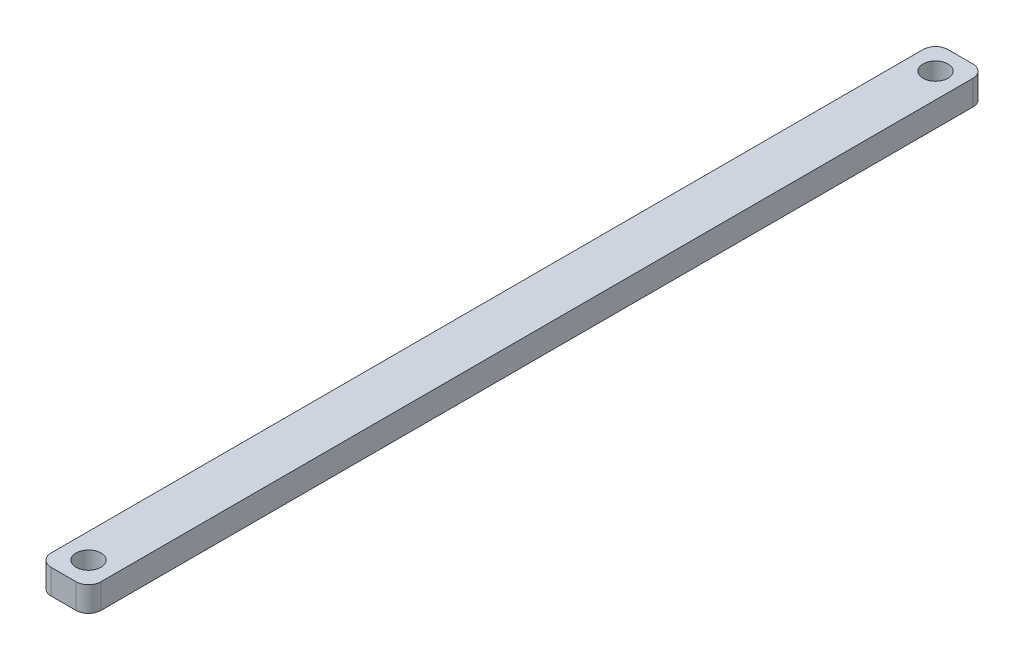
from build123d import *

# Parameters (mm, degrees)
SKETCH1_W           = 25.4
SKETCH1_H           = 457.2
BOSS_EXTRUDE1_DEPTH = 6.35
FILLET1_R           = 6.35
SKETCH2_R           = 6.35
CUT_EXTRUDE1_DEPTH  = 230.304470083


with BuildPart() as part:
    # Sketch1 → Boss-Extrude1 (new, symmetric)
    with BuildSketch(Plane(origin=(0, 0, 0), x_dir=(1, 0, 0), z_dir=(0, 1, 0))):
        Rectangle(SKETCH1_W, SKETCH1_H)
    extrude(amount=BOSS_EXTRUDE1_DEPTH, both=True)

    # Fillet1
    fillet1_edges = [part.edges().sort_by_distance(p)[0] for p in [
        (12.7, 0, -228.6),
        (-12.7, 0, -228.6),
        (12.7, 0, 228.6),
        (-12.7, 0, 228.6),
    ]]
    fillet(fillet1_edges, radius=FILLET1_R)

    # Sketch2 → Cut-Extrude1 (cut, through all)
    with BuildSketch(Plane(origin=(0, 6.35, 0), x_dir=(1, 0, 0), z_dir=(0, 1, 0))):
        with Locations((0, 215.9)):
            Circle(SKETCH2_R)
    cut_extrude1 = extrude(amount=-CUT_EXTRUDE1_DEPTH, mode=Mode.SUBTRACT)

    # Mirror2: Cut-Extrude1 across plane
    add(cut_extrude1.mirror(Plane.XY), mode=Mode.SUBTRACT)


solid = part.part
